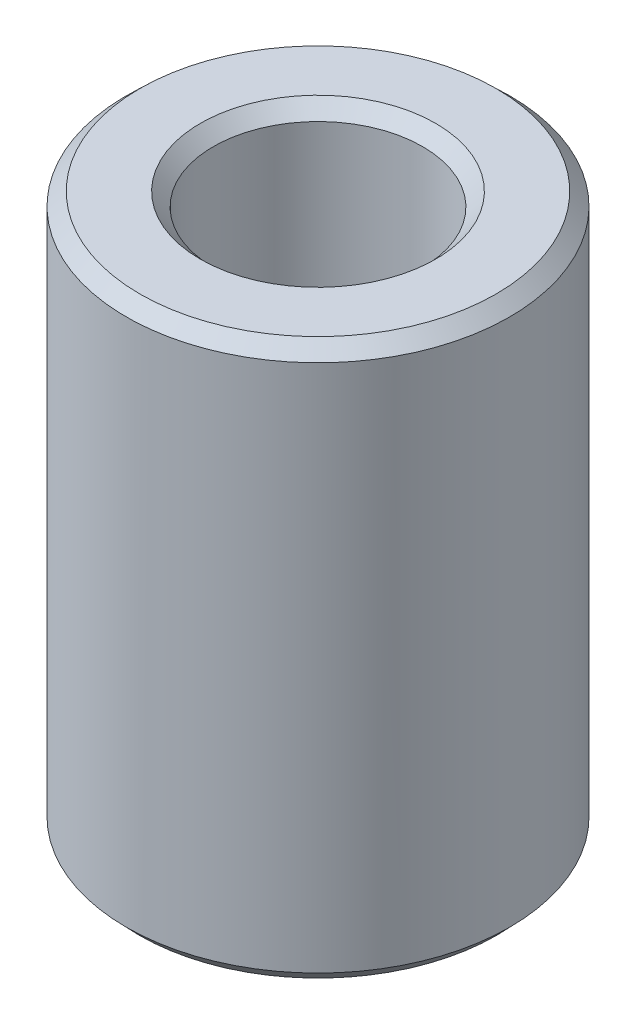
from build123d import *
from OCP.BRepFilletAPI import BRepFilletAPI_MakeChamfer

# Parameters (mm, degrees)
SKETCH1_R           = 10
BOSS_EXTRUDE1_DEPTH = 28.969479008
SKETCH2_R           = 5.459335339
CUT_EXTRUDE1_DEPTH  = 33.237101514
CHAMFER1_SIZE       = 0.681148641
CHAMFER1_SIZE2      = 0.70866039


with BuildPart() as part:
    # Sketch1 → Boss-Extrude1 (new body)
    with BuildSketch(Plane(origin=(0, 0, 0), x_dir=(1, 0, 0), z_dir=(0, 1, 0))):
        Circle(SKETCH1_R)
    extrude(amount=BOSS_EXTRUDE1_DEPTH)

    # Sketch2 → Cut-Extrude1 (cut, through all)
    with BuildSketch(Plane(origin=(0, 0, 0), x_dir=(1, 0, 0), z_dir=(0, 1, 0))):
        Circle(SKETCH2_R)
    extrude(amount=CUT_EXTRUDE1_DEPTH, mode=Mode.SUBTRACT)

    # Chamfer1: one chamfer whose edges measure the first distance from different faces: ONE call of the kernel's chamfer builder (chamfer() names one face for all edges)
    chamfer1_edges_1 = [part.edges().sort_by_distance(p)[0] for p in [
        (-5.459335339, 28.969479008, 0),
    ]]
    chamfer1_side_1 = [part.faces().sort_by_distance(p)[0] for p in [
        (-9.717157288, 28.969479008, 0),
    ]]
    chamfer1_edges_2 = [part.edges().sort_by_distance(p)[0] for p in [
        (-5.459335339, 0, 0),
    ]]
    chamfer1_side_2 = [part.faces().sort_by_distance(p)[0] for p in [
        (-5.459335339, 14.484739504, 0),
    ]]
    chamfer1_edges_3 = [part.edges().sort_by_distance(p)[0] for p in [
        (-10, 0, 0),
    ]]
    chamfer1_side_3 = [part.faces().sort_by_distance(p)[0] for p in [
        (-9.717157288, 0, 0),
    ]]
    chamfer1_edges_4 = [part.edges().sort_by_distance(p)[0] for p in [
        (-10, 28.969479008, 0),
    ]]
    chamfer1_side_4 = [part.faces().sort_by_distance(p)[0] for p in [
        (-10, 14.484739504, 0),
    ]]
    chamfer1 = BRepFilletAPI_MakeChamfer(part.part.solid().wrapped)
    for e in chamfer1_edges_1:
        chamfer1.Add(CHAMFER1_SIZE, CHAMFER1_SIZE2, e.wrapped, chamfer1_side_1[0].wrapped)  # the first distance lies on this face
    for e in chamfer1_edges_2:
        chamfer1.Add(CHAMFER1_SIZE, CHAMFER1_SIZE2, e.wrapped, chamfer1_side_2[0].wrapped)  # the first distance lies on this face
    for e in chamfer1_edges_3:
        chamfer1.Add(CHAMFER1_SIZE, CHAMFER1_SIZE2, e.wrapped, chamfer1_side_3[0].wrapped)  # the first distance lies on this face
    for e in chamfer1_edges_4:
        chamfer1.Add(CHAMFER1_SIZE, CHAMFER1_SIZE2, e.wrapped, chamfer1_side_4[0].wrapped)  # the first distance lies on this face
    add(Compound.cast(chamfer1.Shape()), mode=Mode.REPLACE)


solid = part.part
